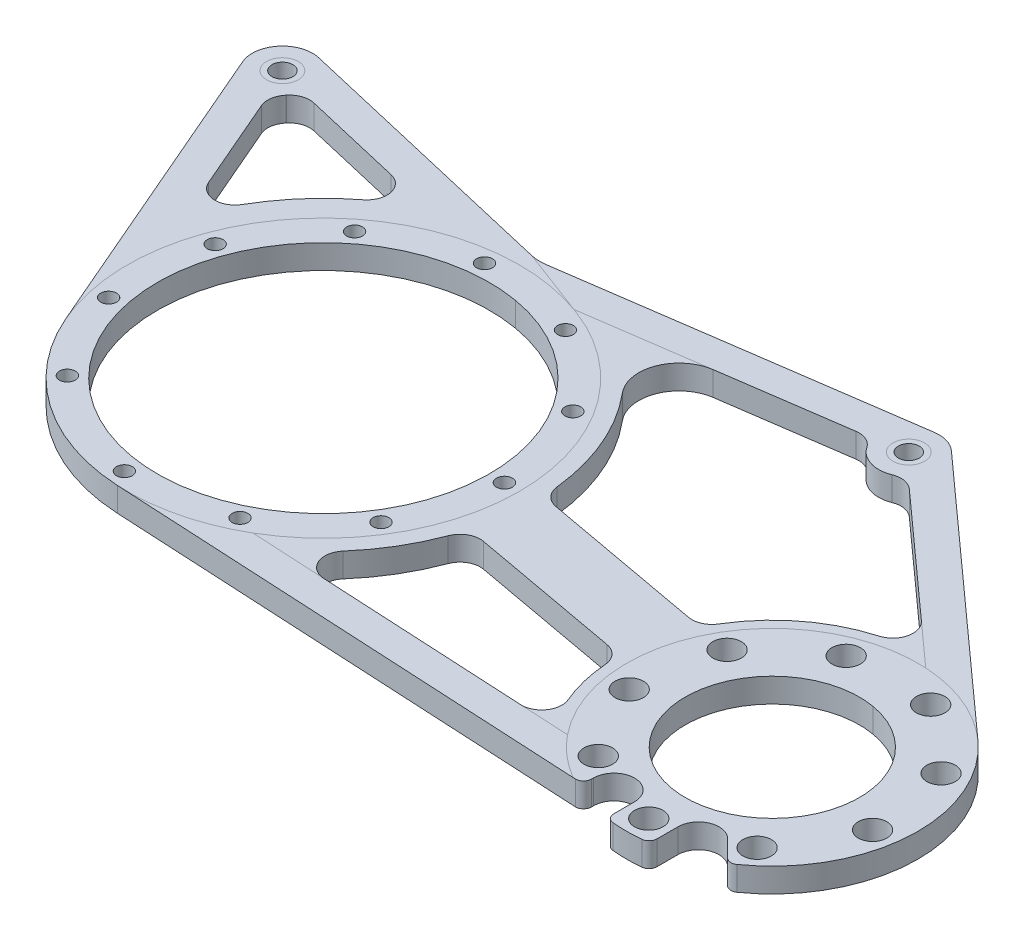
from build123d import *

# Parameters (mm, degrees)
SKETCH2_R             = 2.5
SKETCH2_R_2           = 4.5
SKETCH2_R_3           = 27.4955
SKETCH2_R_4           = 3.3
BOSS_EXTRUDE1_DEPTH   = 7.62
CUT_EXTRUDE1_DEPTH    = 977.654400972
FILLET2_R             = 12.7
CUT_EXTRUDE2_DEPTH    = 977.654400972
CIRPATTERN2_START     = 31.381947118
CIRPATTERN2_OUTLINE_R = 2.5
CIRPATTERN2_DEPTH     = 7.62
FILLET4_R             = 6.3754
CUT_EXTRUDE4_DEPTH    = 977.654400972
FILLET5_R             = 6.3754
FILLET6_R             = 6.3754
FILLET7_R             = 12.7


# Read off the part's stored shape, not the designer's step: CirPattern2
with BuildPart() as part:
    # Sketch2 → Boss-Extrude1 (new body)
    # profile 1 of 10: a face of its own
    with BuildSketch(Plane(origin=(0, 31.381947118, 0), x_dir=(1, 0, 0), z_dir=(0, 1, 0))):
        with BuildLine():
            ThreePointArc((-913.231203194, -139.306107665), (-891.842137326, -162.294673087), (-861.92593364, -171.83338557))
            ThreePointArc((-861.92593364, -171.83338557), (-820.11475592, -158.430942405), (-797.704649202, -120.673993615))
            ThreePointArc((-797.704649202, -120.673993615), (-797.01050218, -115.359784371), (-796.77854046, -110.005453999))
            ThreePointArc((-796.77854046, -110.005453999), (-871.210429691, -49.371943878), (-915.540423748, -134.526980787))
            ThreePointArc((-915.540423748, -134.526980787), (-914.437051565, -136.941301899), (-913.231203194, -139.306107665))
        make_face()
        with Locations((-864.664842136, -166.842380319)):
            Circle(SKETCH2_R, mode=Mode.SUBTRACT)
        with BuildLine():
            ThreePointArc((-806.30354046, -110.005453999), (-806.499815761, -114.536041237), (-807.087170934, -119.032679828))
            ThreePointArc((-807.087170934, -119.032679828), (-910.882265158, -105.474866761), (-806.30354046, -110.005453999))
        make_face(mode=Mode.SUBTRACT)
    # profile 2 of 10: a face of its own
    with BuildSketch(Plane(origin=(0, 31.381947118, 0), x_dir=(1, 0, 0), z_dir=(0, 1, 0))):
        with BuildLine():
            ThreePointArc((-663.719686073, -177.370678379), (-662.142049476, -178.105218992), (-660.461885462, -177.651858179))
            ThreePointArc((-660.461885462, -177.651858179), (-688.572459971, -94.109699917), (-710.607035859, -179.455901191))
            ThreePointArc((-710.607035859, -179.455901191), (-708.047835111, -179.48984757), (-706.758334948, -177.278999281))
            Line((-706.758334948, -177.278999281), (-706.758334948, -176.701988839))
            ThreePointArc((-706.758334948, -176.701988839), (-700.258334948, -170.201988839), (-693.758334948, -176.701988839))
            Line((-693.758334948, -176.701988839), (-693.758334948, -183.274721629))
            ThreePointArc((-693.758334948, -183.274721629), (-693.101169654, -184.979577479), (-691.469725918, -185.802250576))
            ThreePointArc((-691.469725918, -185.802250576), (-686.919549358, -186.027976628), (-682.369372798, -185.802250576))
            ThreePointArc((-682.369372798, -185.802250576), (-680.737929062, -184.979577479), (-680.080763768, -183.274721629))
            Line((-680.080763768, -183.274721629), (-680.080763768, -176.701988839))
            ThreePointArc((-680.080763768, -176.701988839), (-676.068206079, -170.696771877), (-668.984569691, -172.105794761))
            Line((-668.984569691, -172.105794761), (-663.719686073, -177.370678379))
        make_face()
        with Locations((-686.919549358, -179.053976628)):
            Circle(SKETCH2_R_2, mode=Mode.SUBTRACT)
        with Locations((-661.85083258, -169.92970991)):
            Circle(SKETCH2_R_2, mode=Mode.SUBTRACT)
        with Locations((-648.51204699, -146.826255557)):
            Circle(SKETCH2_R_2, mode=Mode.SUBTRACT)
        with Locations((-653.14455861, -120.553976628)):
            Circle(SKETCH2_R_2, mode=Mode.SUBTRACT)
        with Locations((-673.580763768, -103.405964417)):
            Circle(SKETCH2_R_2, mode=Mode.SUBTRACT)
        with Locations((-700.258334948, -103.405964417)):
            Circle(SKETCH2_R_2, mode=Mode.SUBTRACT)
        with Locations((-720.694540106, -120.553976628)):
            Circle(SKETCH2_R_2, mode=Mode.SUBTRACT)
        with Locations((-725.327051725, -146.826255557)):
            Circle(SKETCH2_R_2, mode=Mode.SUBTRACT)
        with Locations((-711.988266136, -169.92970991)):
            Circle(SKETCH2_R_2, mode=Mode.SUBTRACT)
        with Locations((-686.919549358, -140.053976628)):
            Circle(SKETCH2_R_3, mode=Mode.SUBTRACT)
    # profile 3 of 10: a face of its own
    with BuildSketch(Plane(origin=(0, 31.381947118, 0), x_dir=(1, 0, 0), z_dir=(0, 1, 0))):
        with BuildLine():
            Line((-861.92593364, -171.83338557), (-709.563399524, -179.805130863))
            ThreePointArc((-709.563399524, -179.805130863), (-710.104359013, -179.687717863), (-710.607035859, -179.455901191))
            ThreePointArc((-710.607035859, -179.455901191), (-728.743420505, -159.142519743), (-732.205854251, -132.131902082))
            Line((-732.205854251, -132.131902082), (-797.704649202, -120.673993615))
            ThreePointArc((-797.704649202, -120.673993615), (-820.11475592, -158.430942405), (-861.92593364, -171.83338557))
        make_face()
    # profile 4 of 10: a face of its own
    with BuildSketch(Plane(origin=(0, 31.381947118, 0), x_dir=(1, 0, 0), z_dir=(0, 1, 0))):
        with BuildLine():
            ThreePointArc((-796.77854046, -110.005453999), (-797.01050218, -115.359784371), (-797.704649202, -120.673993615))
            Line((-797.704649202, -120.673993615), (-732.205854251, -132.131902082))
            ThreePointArc((-732.205854251, -132.131902082), (-701.928176702, -96.598829853), (-656.175138478, -105.872258186))
            Line((-656.175138478, -105.872258186), (-734.471346389, -35.449503096))
            Line((-734.471346389, -35.449503096), (-737.45167366, -41.840835553))
            ThreePointArc((-737.45167366, -41.840835553), (-749.026894919, -46.874452701), (-755.434553976, -35.999483543))
            Line((-755.434553976, -35.999483543), (-753.896931719, -28.08212915))
            Line((-753.896931719, -28.08212915), (-944.165914661, -23.010008435))
            Line((-944.165914661, -23.010008435), (-941.416205936, -26.93699947))
            ThreePointArc((-941.416205936, -26.93699947), (-940.134475202, -29.536092286), (-939.693629158, -32.400315026))
            ThreePointArc((-939.693629158, -32.400315026), (-945.26796105, -41.067370264), (-955.466405327, -39.589954651))
            Line((-955.466405327, -39.589954651), (-957.104925163, -38.166085623))
            Line((-957.104925163, -38.166085623), (-915.540423748, -134.526980787))
            ThreePointArc((-915.540423748, -134.526980787), (-871.210429691, -49.371943878), (-796.77854046, -110.005453999))
        make_face()
    # profile 5 of 10: a face of its own
    with BuildSketch(Plane(origin=(0, 31.381947118, 0), x_dir=(1, 0, 0), z_dir=(0, 1, 0))):
        with BuildLine():
            ThreePointArc((-755.434553976, -35.999483543), (-749.026894919, -46.874452701), (-737.45167366, -41.840835553))
            ThreePointArc((-737.45167366, -41.840835553), (-736.785035864, -39.876983933), (-736.559255332, -37.81539661))
            ThreePointArc((-736.559255332, -37.81539661), (-737.383766778, -33.938913161), (-739.714556945, -30.733548866))
            ThreePointArc((-739.714556945, -30.733548866), (-742.67316861, -28.92213442), (-746.084255332, -28.29039661))
            ThreePointArc((-746.084255332, -28.29039661), (-752.143506648, -30.466172264), (-755.434553976, -35.999483543))
        make_face()
        with BuildLine():
            ThreePointArc((-742.844781786, -38.444531846), (-746.713390568, -41.054870156), (-749.323728878, -37.186261374))
            ThreePointArc((-749.323728878, -37.186261374), (-745.455120096, -34.575923064), (-742.844781786, -38.444531846))
        make_face(mode=Mode.SUBTRACT)
    # profile 6 of 10: a face of its own
    with BuildSketch(Plane(origin=(0, 31.381947118, 0), x_dir=(1, 0, 0), z_dir=(0, 1, 0))):
        with BuildLine():
            Line((-753.896931719, -28.08212915), (-755.434553976, -35.999483543))
            ThreePointArc((-755.434553976, -35.999483543), (-752.143506648, -30.466172264), (-746.084255332, -28.29039661))
            Line((-746.084255332, -28.29039661), (-753.896931719, -28.08212915))
        make_face()
    # profile 7 of 10: a face of its own
    with BuildSketch(Plane(origin=(0, 31.381947118, 0), x_dir=(1, 0, 0), z_dir=(0, 1, 0))):
        with BuildLine():
            Line((-737.45167366, -41.840835553), (-734.471346389, -35.449503096))
            Line((-734.471346389, -35.449503096), (-739.714556945, -30.733548866))
            ThreePointArc((-739.714556945, -30.733548866), (-737.383766778, -33.938913161), (-736.559255332, -37.81539661))
            ThreePointArc((-736.559255332, -37.81539661), (-736.785035864, -39.876983933), (-737.45167366, -41.840835553))
        make_face()
    # profile 8 of 10: a face of its own
    with BuildSketch(Plane(origin=(0, 31.381947118, 0), x_dir=(1, 0, 0), z_dir=(0, 1, 0))):
        with BuildLine():
            Line((-957.964688125, -36.172857609), (-957.104925163, -38.166085623))
            Line((-957.104925163, -38.166085623), (-955.466405327, -39.589954651))
            ThreePointArc((-955.466405327, -39.589954651), (-956.907771572, -38.021944143), (-957.964688125, -36.172857609))
        make_face()
    # profile 9 of 10: a face of its own
    with BuildSketch(Plane(origin=(0, 31.381947118, 0), x_dir=(1, 0, 0), z_dir=(0, 1, 0))):
        with BuildLine():
            ThreePointArc((-948.71116187, -22.888842903), (-944.596891068, -24.071739996), (-941.416205936, -26.93699947))
            Line((-941.416205936, -26.93699947), (-944.165914661, -23.010008435))
            Line((-944.165914661, -23.010008435), (-948.71116187, -22.888842903))
        make_face()
    # profile 10 of 10: a face of its own
    with BuildSketch(Plane(origin=(0, 31.381947118, 0), x_dir=(1, 0, 0), z_dir=(0, 1, 0))):
        with BuildLine():
            ThreePointArc((-957.964688125, -36.172857609), (-956.907771572, -38.021944143), (-955.466405327, -39.589954651))
            ThreePointArc((-955.466405327, -39.589954651), (-945.26796105, -41.067370264), (-939.693629158, -32.400315026))
            ThreePointArc((-939.693629158, -32.400315026), (-940.134475202, -29.536092286), (-941.416205936, -26.93699947))
            ThreePointArc((-941.416205936, -26.93699947), (-944.596891068, -24.071739996), (-948.71116187, -22.888842903))
            Line((-948.71116187, -22.888842903), (-949.218629158, -22.875315026))
            ThreePointArc((-949.218629158, -22.875315026), (-957.176615495, -27.166188695), (-957.964688125, -36.172857609))
        make_face()
        with Locations((-949.218629158, -32.400315026)):
            Circle(SKETCH2_R_4, mode=Mode.SUBTRACT)
    extrude(amount=BOSS_EXTRUDE1_DEPTH)

    # Sketch3 → Cut-Extrude1 (cut, through all)
    with BuildSketch(Plane.XZ.offset(-31.381947118)):
        Polygon((-753.896931719, 28.08212915), (-754.143531549, 29.351893709), (-856.972172798, 44.147094697), (-943.505934216, 23.952558192), (-944.165914661, 23.010008435), align=None)
        with BuildLine():
            Line((-948.71116187, 22.888842903), (-944.165914661, 23.010008435))
            Line((-944.165914661, 23.010008435), (-943.505934216, 23.952558192))
            Line((-943.505934216, 23.952558192), (-947.053929007, 23.124556391))
            ThreePointArc((-947.053929007, 23.124556391), (-947.877357404, 22.970224089), (-948.71116187, 22.888842903))
        make_face()
        with BuildLine():
            Line((-753.896931719, 28.08212915), (-746.084255332, 28.29039661))
            ThreePointArc((-746.084255332, 28.29039661), (-746.764244179, 28.314699785), (-747.440763024, 28.387485289))
            Line((-747.440763024, 28.387485289), (-754.143531549, 29.351893709))
            Line((-754.143531549, 29.351893709), (-753.896931719, 28.08212915))
        make_face()
    extrude(amount=-CUT_EXTRUDE1_DEPTH, mode=Mode.SUBTRACT)

    # Fillet2
    fillet2_edges = [part.edges().sort_by_distance(p)[0] for p in [
        (-856.972172798, 35.191947118, 44.147094697),
    ]]
    fillet(fillet2_edges, radius=FILLET2_R)

    # Sketch4 → Cut-Extrude2 (cut, through all)
    with BuildSketch(Plane.XZ.offset(-31.381947118)):
        with BuildLine():
            Line((-709.563399524, 179.805130863), (-709.298334948, 179.818999281))
            ThreePointArc((-709.298334948, 179.818999281), (-709.431048514, 179.815529807), (-709.563399524, 179.805130863))
        make_face()
        with BuildLine():
            Line((-924.603702119, 87.862970189), (-944.871408741, 40.875413825))
            ThreePointArc((-944.871408741, 40.875413825), (-941.911570095, 38.510348812), (-940.107819617, 35.178583284))
            Line((-940.107819617, 35.178583284), (-888.550368384, 47.2106366))
            ThreePointArc((-888.550368384, 47.2106366), (-910.712397168, 63.869275109), (-924.603702119, 87.862970189))
        make_face()
    extrude(amount=-CUT_EXTRUDE2_DEPTH, mode=Mode.SUBTRACT)

    # CirPattern2 outline → CirPattern2 (cut)
    with BuildSketch(Plane(origin=(0, 0, 0), x_dir=(1, 0, 0), z_dir=(0, 1, 0)).offset(CIRPATTERN2_START)):
        with Locations((-899.801310049, -149.705179871)):
            Circle(CIRPATTERN2_OUTLINE_R)
        with Locations((-914.592175842, -121.887607129)):
            Circle(CIRPATTERN2_OUTLINE_R)
        with Locations((-912.394473738, -90.459002808)):
            Circle(CIRPATTERN2_OUTLINE_R)
        with Locations((-893.876093775, -64.97063943)):
            Circle(CIRPATTERN2_OUTLINE_R)
        with Locations((-864.664842136, -53.168527679)):
            Circle(CIRPATTERN2_OUTLINE_R)
        with Locations((-833.638129421, -58.639374253)):
            Circle(CIRPATTERN2_OUTLINE_R)
        with Locations((-810.225091765, -79.720568048)):
            Circle(CIRPATTERN2_OUTLINE_R)
        with Locations((-801.54104046, -110.005453999)):
            Circle(CIRPATTERN2_OUTLINE_R)
        with Locations((-810.225091765, -140.29033995)):
            Circle(CIRPATTERN2_OUTLINE_R)
        with Locations((-833.638129421, -161.371533745)):
            Circle(CIRPATTERN2_OUTLINE_R)
    extrude(amount=CIRPATTERN2_DEPTH, mode=Mode.SUBTRACT)

    # Fillet4
    fillet4_edges = [part.edges().sort_by_distance(p)[0] for p in [
        (-940.107819617, 35.191947118, 35.178583284),
        (-944.871408741, 35.191947118, 40.875413825),
        (-924.603702119, 35.191947118, 87.862970189),
        (-888.550368384, 35.191947118, 47.2106366),
    ]]
    fillet(fillet4_edges, radius=FILLET4_R)

    # Sketch10 → Cut-Extrude4 (cut, through all)
    with BuildSketch(Plane.XZ.offset(-31.381947118)):
        with BuildLine():
            Line((-818.912925661, 163.909968089), (-726.837683008, 168.727427883))
            ThreePointArc((-726.837683008, 168.727427883), (-733.865361894, 154.604402269), (-736.056867451, 138.982448921))
            Line((-736.056867451, 138.982448921), (-794.259845382, 128.352556144))
            ThreePointArc((-794.259845382, 128.352556144), (-803.636726802, 148.176353962), (-818.912925661, 163.909968089))
        make_face()
        with BuildLine():
            Line((-791.745025376, 107.510234448), (-731.129548627, 118.580733611))
            ThreePointArc((-731.129548627, 118.580733611), (-713.453111449, 98.682557946), (-687.995575057, 90.916756828))
            Line((-687.995575057, 90.916756828), (-739.442809112, 44.643047532))
            ThreePointArc((-739.442809112, 44.643047532), (-748.851749471, 46.929484671), (-755.400758562, 39.797413906))
            Line((-755.400758562, 39.797413906), (-828.325614891, 50.289995479))
            ThreePointArc((-828.325614891, 50.289995479), (-802.247103164, 73.921149949), (-791.745025376, 107.510234448))
        make_face()
    extrude(amount=-CUT_EXTRUDE4_DEPTH, mode=Mode.SUBTRACT)

    # Fillet5
    fillet5_edges = [part.edges().sort_by_distance(p)[0] for p in [
        (-794.259845382, 35.191947118, 128.352556144),
        (-818.912925661, 35.191947118, 163.909968089),
        (-726.837683008, 35.191947118, 168.727427883),
        (-736.056867451, 35.191947118, 138.982448921),
        (-739.442809112, 35.191947118, 44.643047532),
        (-755.400758562, 35.191947118, 39.797413906),
        (-731.129548627, 35.191947118, 118.580733611),
        (-687.995575057, 35.191947118, 90.916756828),
    ]]
    fillet(fillet5_edges, radius=FILLET5_R)

    # Fillet6
    fillet6_edges = [part.edges().sort_by_distance(p)[0] for p in [
        (-791.745025376, 35.191947118, 107.510234448),
    ]]
    fillet(fillet6_edges, radius=FILLET6_R)

    # Fillet7
    fillet7_edges = [part.edges().sort_by_distance(p)[0] for p in [
        (-828.325614891, 35.191947118, 50.289995479),
    ]]
    fillet(fillet7_edges, radius=FILLET7_R)


solid = part.part
